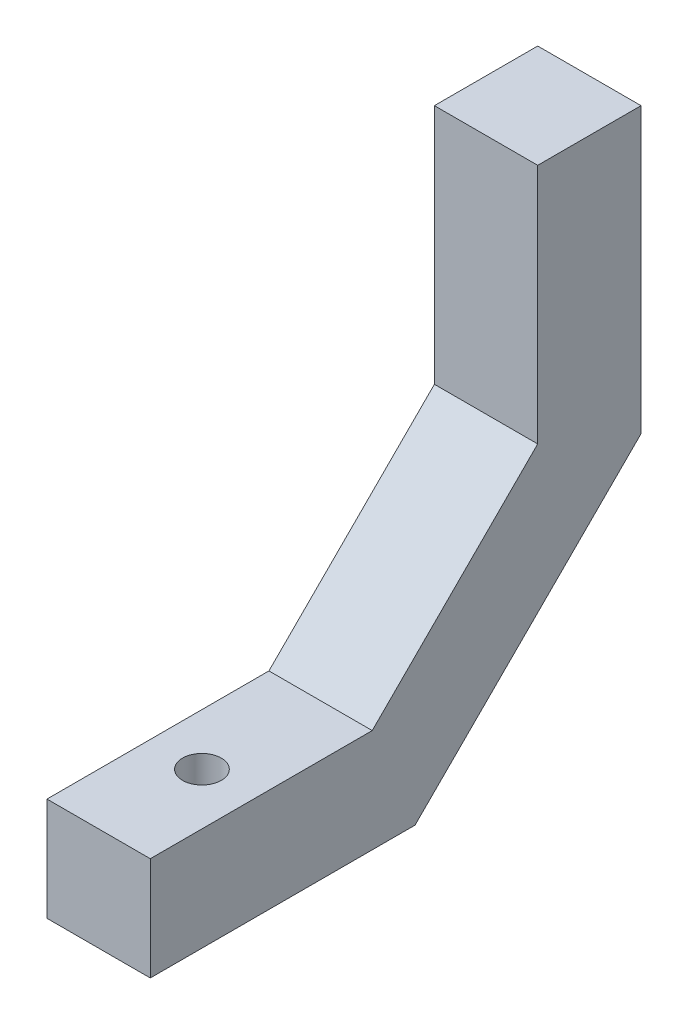
from build123d import *

# Parameters (mm, degrees)
BOSS_EXTRUDE1_DEPTH      = 4
BOSS_EXTRUDE1_DEPTH_BACK = 4
SKETCH3_R                = 1.5
CUT_EXTRUDE1_DEPTH       = 50.520197899


with BuildPart() as part:
    # Sketch1 → Boss-Extrude1 (new, two sides: drawn at the far end of the back side and taken through both)
    with BuildSketch(Plane(origin=(0, 0, 0), x_dir=(0, 0, -1), z_dir=(1, 0, 0)).offset(-BOSS_EXTRUDE1_DEPTH_BACK)):
        Polygon((-8, 4), (0, 4), (0, -18), (-17.5, -35.5), (-30, -35.5), (-38, -35.5), (-38, -27.5), (-30, -27.5), (-20.813708499, -27.5), (-8, -14.686291501), align=None)
    extrude(amount=BOSS_EXTRUDE1_DEPTH + BOSS_EXTRUDE1_DEPTH_BACK)

    # Sketch3 → Cut-Extrude1 (cut, through all)
    with BuildSketch(Plane(origin=(0, -27.5, 0), x_dir=(1, 0, 0), z_dir=(0, 1, 0))):
        with Locations((0, -30)):
            Circle(SKETCH3_R)
    extrude(amount=-CUT_EXTRUDE1_DEPTH, mode=Mode.SUBTRACT)


solid = part.part
